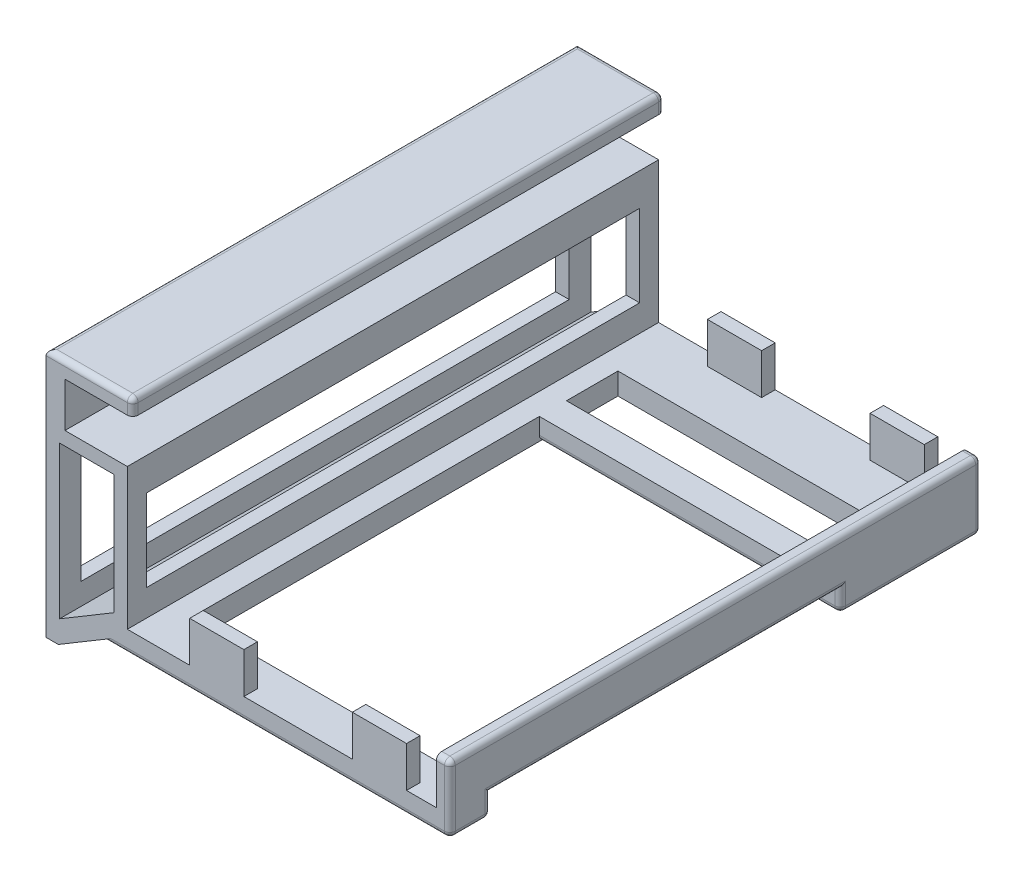
from build123d import *

# Parameters (mm, degrees)
EXTRUDE_1_DEPTH        = 196
CUT_EXTRUDE_1_DEPTH    = 240.62524927
SKETCH_4_W             = 106
SKETCH_4_H             = 19
CUT_EXTRUDE_2_DEPTH    = 242.065053461
SKETCH_6_W             = 106
SKETCH_6_H             = 129
CUT_EXTRUDE_3_DEPTH    = 242.065053461
SKETCH_7_W             = 20
SKETCH_7_H             = 5
EXTRUDE_3_DEPTH        = 15
PATTERN_LINEAR_1_COUNT = 2
PATTERN_LINEAR_1_PITCH = 60
CUT_EXTRUDE_6_REACH    = 244.147
SKETCH_10_W            = 182
SKETCH_10_H            = 30.218365382
CUT_EXTRUDE_7_REACH    = 254.973
SKETCH_12_W            = 180
SKETCH_12_H            = 40.166727714
CUT_EXTRUDE_8_REACH    = 254.973
SKETCH_13_W            = 129
SKETCH_13_H            = 8
SKETCH_14_W            = 20
SKETCH_14_H            = 5
EXTRUDE_4_DEPTH        = 15
PATTERN_LINEAR_2_COUNT = 2
PATTERN_LINEAR_2_PITCH = 60
FILLET_1_R             = 2
FILLET_2_R             = 2
FILLET_3_R             = 2
FILLET_4_R             = 2


with BuildPart() as part:
    # 草图1 → 凸台-拉伸1 (new body)
    with BuildSketch(Plane.XY):
        Polygon((0, 0), (-23, 0), (-23, 16.4), (2, 16.4), (2, 22.4), (-30, 22.4), (-30, -69.593534811), (-25.456561805, -69.593534811), (-9.398235911, -60), (119, -60), (119, -35), (114, -35), (114, -52), (0, -52), align=None)
    extrude(amount=EXTRUDE_1_DEPTH)

    # 草图2 → 切除-拉伸1 (cut, through all)
    with BuildSketch(Plane.XY.offset(196)):
        Polygon((-25, -5), (-25, -61.166727714), (-5, -49.218365382), (-5, -5), align=None)
    extrude(amount=-CUT_EXTRUDE_1_DEPTH, mode=Mode.SUBTRACT)

    # 草图4 → 切除-拉伸2 (cut, through all)
    with BuildSketch(Plane(origin=(0, -52, 0), x_dir=(1, 0, 0), z_dir=(0, 1, 0))):
        with Locations((61, -32.5)):
            Rectangle(SKETCH_4_W, SKETCH_4_H)
    extrude(amount=-CUT_EXTRUDE_2_DEPTH, mode=Mode.SUBTRACT)

    # 草图6 → 切除-拉伸3 (cut, through all)
    with BuildSketch(Plane(origin=(0, -52, 0), x_dir=(1, 0, 0), z_dir=(0, 1, 0))):
        with Locations((61, -116.5)):
            Rectangle(SKETCH_6_W, SKETCH_6_H)
    extrude(amount=-CUT_EXTRUDE_3_DEPTH, mode=Mode.SUBTRACT)

    # 草图7 → 凸台-拉伸3 (add)
    with BuildSketch(Plane(origin=(0, -52, 0), x_dir=(1, 0, 0), z_dir=(0, 1, 0))):
        with Locations((33, -193.5)):
            Rectangle(SKETCH_7_W, SKETCH_7_H)
    extrude_3 = extrude(amount=EXTRUDE_3_DEPTH)

    # 阵列(线性)1: 凸台-拉伸3 ×2
    with Locations(*[(i * PATTERN_LINEAR_1_PITCH, 0, 0) for i in range(1, PATTERN_LINEAR_1_COUNT)]):
        add(extrude_3)

    # 草图10 → 切除-拉伸6 (cut, up to next)
    with BuildSketch(Plane.ZY.offset(5), mode=Mode.PRIVATE) as cut_extrude_6_sk1:
        with Locations((98, -27.109182691)):
            Rectangle(SKETCH_10_W, SKETCH_10_H)
    cut_extrude_6_tool1 = extrude(cut_extrude_6_sk1.sketch, amount=-CUT_EXTRUDE_6_REACH, mode=Mode.PRIVATE) & part.part
    add(cut_extrude_6_tool1.solids().sort_by_distance((-5, -27.109183, 98))[0], mode=Mode.SUBTRACT)

    # 草图12 → 切除-拉伸7 (cut, up to next)
    with BuildSketch(Plane(origin=(-25, 0, 0), x_dir=(0, 0, -1), z_dir=(1, 0, 0)), mode=Mode.PRIVATE) as cut_extrude_7_sk1:
        with Locations((-98, -33.083363857)):
            Rectangle(SKETCH_12_W, SKETCH_12_H)
    cut_extrude_7_tool1 = extrude(cut_extrude_7_sk1.sketch, amount=-CUT_EXTRUDE_7_REACH, mode=Mode.PRIVATE) & part.part
    add(cut_extrude_7_tool1.solids().sort_by_distance((-25, -33.083364, 98))[0], mode=Mode.SUBTRACT)

    # 草图13 → 切除-拉伸8 (cut, up to next)
    with BuildSketch(Plane.ZY.offset(-114), mode=Mode.PRIVATE) as cut_extrude_8_sk1:
        with Locations((116.5, -56)):
            Rectangle(SKETCH_13_W, SKETCH_13_H)
    cut_extrude_8_tool1 = extrude(cut_extrude_8_sk1.sketch, amount=-CUT_EXTRUDE_8_REACH, mode=Mode.PRIVATE) & part.part
    add(cut_extrude_8_tool1.solids().sort_by_distance((114, -56, 116.5))[0], mode=Mode.SUBTRACT)

    # 草图14 → 凸台-拉伸4 (add)
    with BuildSketch(Plane(origin=(0, -52, 0), x_dir=(1, 0, 0), z_dir=(0, 1, 0))):
        with Locations((33, -2.5)):
            Rectangle(SKETCH_14_W, SKETCH_14_H)
    extrude_4 = extrude(amount=EXTRUDE_4_DEPTH)

    # 阵列(线性)2: 凸台-拉伸4 ×2
    with Locations(*[(i * PATTERN_LINEAR_2_PITCH, 0, 0) for i in range(1, PATTERN_LINEAR_2_COUNT)]):
        add(extrude_4)

    # 圆角1
    fillet_1_edges = [part.edges().sort_by_distance(p)[0] for p in [
        (2, 19.4, 0),
        (-14, 22.4, 0),
        (2, 22.4, 98),
        (-30, 22.4, 98),
        (-14, 22.4, 196),
        (2, 19.4, 196),
    ]]
    fillet(fillet_1_edges, radius=FILLET_1_R)

    # 圆角2
    fillet_2_edges = [part.edges().sort_by_distance(p)[0] for p in [
        (119, -60, 26),
        (119, -47.5, 0),
        (54.800882044, -60, 0),
        (54.800882044, -60, 196),
        (119, -60, 188.5),
        (119, -47.5, 196),
    ]]
    fillet(fillet_2_edges, radius=FILLET_2_R)

    # 圆角3
    fillet_3_edges = [part.edges().sort_by_distance(p)[0] for p in [
        (119, -52, 116.5),
        (115.5, -35, 196),
        (115.5, -35, 0),
        (119, -35, 98),
        (118.414213562, -35, 0.585786438),
        (118.414213562, -35, 195.414213562),
    ]]
    fillet(fillet_3_edges, radius=FILLET_3_R)

    # 圆角4
    fillet_4_edges = [part.edges().sort_by_distance(p)[0] for p in [
        (62.5, -60, 52),
        (118.414213562, -59.414213562, 52),
        (62.5, -60, 181),
        (118.414213562, -59.414213562, 181),
        (119, -54, 52),
        (119, -54, 181),
    ]]
    fillet(fillet_4_edges, radius=FILLET_4_R - 0.0001)  # a hair under: the kernel refuses the full size


solid = part.part
